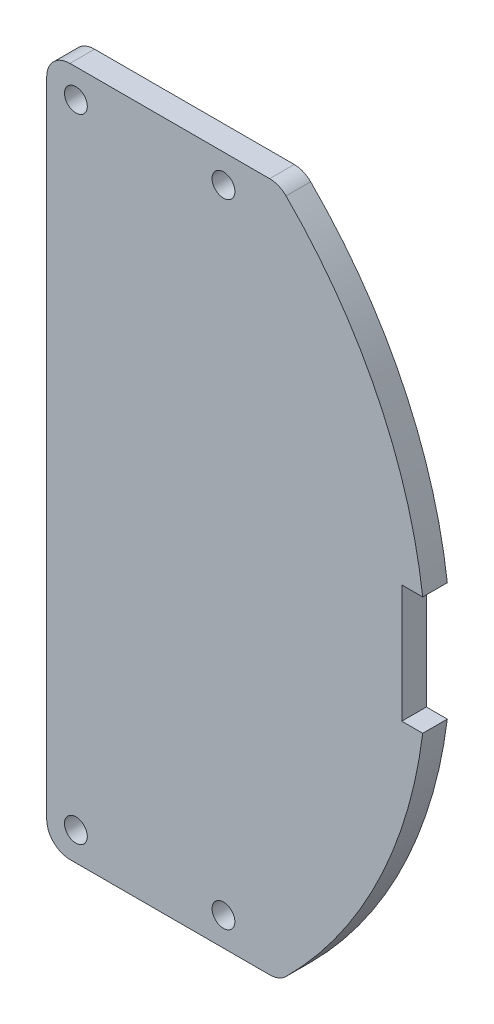
from build123d import *

# Parameters (mm, degrees)
BOSS_EXTRUDE1_DEPTH = 3.175
SKETCH2_R           = 1.4732
CUT_EXTRUDE1_DEPTH  = 77.054419002
CUT_EXTRUDE2_DEPTH  = 77.054419002
FILLET1_R           = 3


with BuildPart() as part:
    # Sketch1 → Boss-Extrude1 (new body)
    with BuildSketch(Plane.XY):
        with BuildLine():
            Line((12.587486719, 44.5), (42.587486719, 44.5))
            ThreePointArc((42.587486719, 44.5), (61.594999998, 0), (42.587486719, -44.5))
            Line((42.587486719, -44.5), (12.587486719, -44.5))
            Line((12.587486719, -44.5), (12.587486719, 44.5))
        make_face()
    extrude(amount=BOSS_EXTRUDE1_DEPTH)

    # Sketch2 → Cut-Extrude1 (cut, through all)
    with BuildSketch(Plane.XY.offset(3.175)):
        with Locations((16.354311186, -40.81189221)):
            Circle(SKETCH2_R)
        with Locations((35.404311186, -40.81189221)):
            Circle(SKETCH2_R)
        with Locations((16.354311186, 40.81189221)):
            Circle(SKETCH2_R)
        with Locations((35.404311186, 40.81189221)):
            Circle(SKETCH2_R)
    extrude(amount=-CUT_EXTRUDE1_DEPTH, mode=Mode.SUBTRACT)

    # Sketch3 → Cut-Extrude2 (cut, through all)
    with BuildSketch(Plane.XY.offset(3.175)):
        with BuildLine():
            Line((58.42, 7.62), (61.121842454, 7.62))
            ThreePointArc((61.121842454, 7.62), (61.595, 0), (61.121842454, -7.62))
            Line((61.121842454, -7.62), (58.42, -7.62))
            Line((58.42, -7.62), (58.42, 7.62))
        make_face()
    extrude(amount=-CUT_EXTRUDE2_DEPTH, mode=Mode.SUBTRACT)

    # Fillet1
    fillet1_edges = [part.edges().sort_by_distance(p)[0] for p in [
        (12.587486719, -44.5, 1.5875),
        (42.587486719, -44.5, 1.5875),
        (12.587486719, 44.5, 1.5875),
        (42.587486719, 44.5, 1.5875),
    ]]
    fillet(fillet1_edges, radius=FILLET1_R)


solid = part.part
